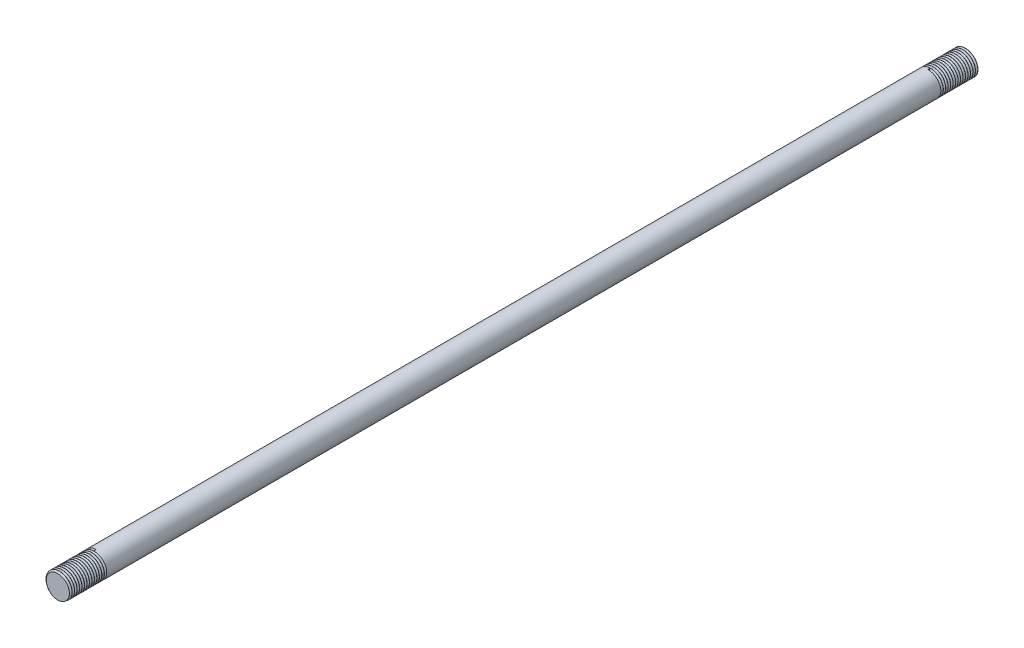
from build123d import *

# Parameters (mm, degrees)
SKETCH1_R           = 5
BOSS_EXTRUDE1_DEPTH = 366.5
CUT_SWEEP1_PITCH    = 1
CUT_SWEEP2_PITCH    = 1


with BuildPart() as part:
    # Sketch1 → Boss-Extrude1 (new body)
    with BuildSketch(Plane.XY):
        Circle(SKETCH1_R)
    extrude(amount=BOSS_EXTRUDE1_DEPTH)

    # Cut-Sweep1: arcs per turn and ends read off the stored shape
    # Cut-Sweep1: the profile of Sketch3 screwed along a right-hand helix through 16 turns, 8 arcs to a turn; built about Z, then put on its axis
    cut_sweep1_z = Axis((0, 0, 0), (0, 0, 1))
    cut_sweep1_corners = [(4.193216793, 0.001699482, -1.053390806), (5.050581942, -0.014048881, -0.558641385), (5.050581942, 0.017447845, -1.548140226)]
    with BuildLine(mode=Mode.PRIVATE) as cut_sweep1_profile:
        Line(cut_sweep1_corners[0], cut_sweep1_corners[1])
        Line(cut_sweep1_corners[1], cut_sweep1_corners[2])
        Line(cut_sweep1_corners[2], cut_sweep1_corners[0])
    cut_sweep1_cap = Face(cut_sweep1_profile.wire())
    cut_sweep1_turn_angles = [0, 22.5, 45, 67.5, 90, 112.5, 135, 157.5, 180, 202.5, 225, 247.5, 270, 292.5, 315, 337.5, 360]
    cut_sweep1_turn_weights = [1, 0.9238795325112867, 1, 0.9238795325112867, 1, 0.9238795325112867, 1, 0.9238795325112867, 1, 0.9238795325112867, 1, 0.9238795325112867, 1, 0.9238795325112867, 1, 0.9238795325112867, 1]
    cut_sweep1_turn_rails = [Edge.make_bspline([Vector(p[0], p[1], 0).rotate(cut_sweep1_z, cut_sweep1_turn_angles[k]) / cut_sweep1_turn_weights[k] + Vector(0, 0, p[2] + CUT_SWEEP1_PITCH * cut_sweep1_turn_angles[k] / 360) for k in range(17)], [0, 0, 0, 1, 1, 2, 2, 3, 3, 4, 4, 5, 5, 6, 6, 7, 7, 8, 8, 8], 2, cut_sweep1_turn_weights) for p in cut_sweep1_corners]
    cut_sweep1_turn_sides = [Face.make_surface_from_curves(cut_sweep1_turn_rails[p[0]], cut_sweep1_turn_rails[p[1]]) for p in [(0, 1), (1, 2), (2, 0)]]
    cut_sweep1 = Plane(origin=(0, 0, 0), x_dir=(0, 1, 0), z_dir=(0, 0, 1)) * Solid(Shell([*[p.moved(Location((0, 0, CUT_SWEEP1_PITCH * i))) for i in range(16) for p in cut_sweep1_turn_sides], cut_sweep1_cap, cut_sweep1_cap.rotate(cut_sweep1_z, 5760).moved(Location((0, 0, CUT_SWEEP1_PITCH * 5760 / 360)))]))
    add(cut_sweep1, mode=Mode.SUBTRACT)

    # Cut-Sweep2: arcs per turn and ends read off the stored shape
    # Cut-Sweep2: the profile of Sketch5 screwed along a right-hand helix through 16 turns, 8 arcs to a turn; built about Z, then put on its axis
    cut_sweep2_z = Axis((0, 0, 0), (0, 0, 1))
    cut_sweep2_corners = [(4.213076098, 0.000986632, -1.030995949), (5.070441248, -0.014761731, -0.536246529), (5.070441248, 0.016734995, -1.52574537)]
    with BuildLine(mode=Mode.PRIVATE) as cut_sweep2_profile:
        Line(cut_sweep2_corners[0], cut_sweep2_corners[1])
        Line(cut_sweep2_corners[1], cut_sweep2_corners[2])
        Line(cut_sweep2_corners[2], cut_sweep2_corners[0])
    cut_sweep2_cap = Face(cut_sweep2_profile.wire())
    cut_sweep2_turn_angles = [0, 22.5, 45, 67.5, 90, 112.5, 135, 157.5, 180, 202.5, 225, 247.5, 270, 292.5, 315, 337.5, 360]
    cut_sweep2_turn_weights = [1, 0.9238795325112867, 1, 0.9238795325112867, 1, 0.9238795325112867, 1, 0.9238795325112867, 1, 0.9238795325112867, 1, 0.9238795325112867, 1, 0.9238795325112867, 1, 0.9238795325112867, 1]
    cut_sweep2_turn_rails = [Edge.make_bspline([Vector(p[0], p[1], 0).rotate(cut_sweep2_z, cut_sweep2_turn_angles[k]) / cut_sweep2_turn_weights[k] + Vector(0, 0, p[2] + CUT_SWEEP2_PITCH * cut_sweep2_turn_angles[k] / 360) for k in range(17)], [0, 0, 0, 1, 1, 2, 2, 3, 3, 4, 4, 5, 5, 6, 6, 7, 7, 8, 8, 8], 2, cut_sweep2_turn_weights) for p in cut_sweep2_corners]
    cut_sweep2_turn_sides = [Face.make_surface_from_curves(cut_sweep2_turn_rails[p[0]], cut_sweep2_turn_rails[p[1]]) for p in [(0, 1), (1, 2), (2, 0)]]
    cut_sweep2 = Plane(origin=(0, 0, 366.5), x_dir=(0, 1, 0), z_dir=(0, 0, -1)) * Solid(Shell([*[p.moved(Location((0, 0, CUT_SWEEP2_PITCH * i))) for i in range(16) for p in cut_sweep2_turn_sides], cut_sweep2_cap, cut_sweep2_cap.rotate(cut_sweep2_z, 5760).moved(Location((0, 0, CUT_SWEEP2_PITCH * 5760 / 360)))]))
    add(cut_sweep2, mode=Mode.SUBTRACT)


solid = part.part
